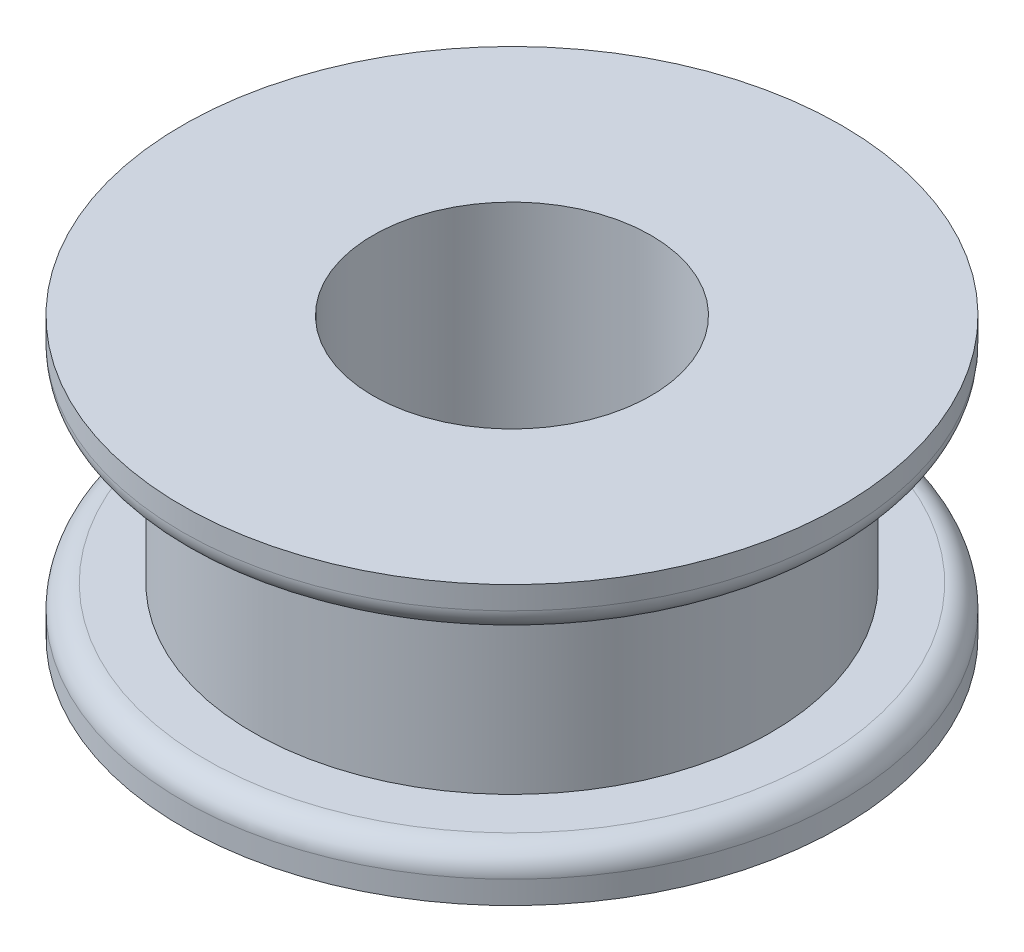
from build123d import *

# Parameters (mm, degrees)
FILLET1_R = 0.508


with BuildPart() as part:
    # Sketch1 → Revolve1 (revolve)
    with BuildSketch(Plane.YZ):
        Polygon((0, 3.000000096), (-6.000000192, 3.000000096), (-6.000000192, 7.112), (-5.00000016, 7.112), (-5.00000016, 5.588), (-1.000000032, 5.588), (-1.000000032, 7.112), (0, 7.112), align=None)
    revolve(axis=Axis((0, -39.041586513, 0), (0, 1, 0)))

    # Fillet1
    fillet1_edges = [part.edges().sort_by_distance(p)[0] for p in [
        (0, -5.00000016, -7.112),
        (0, -1.000000032, -7.112),
    ]]
    fillet(fillet1_edges, radius=FILLET1_R)


solid = part.part
